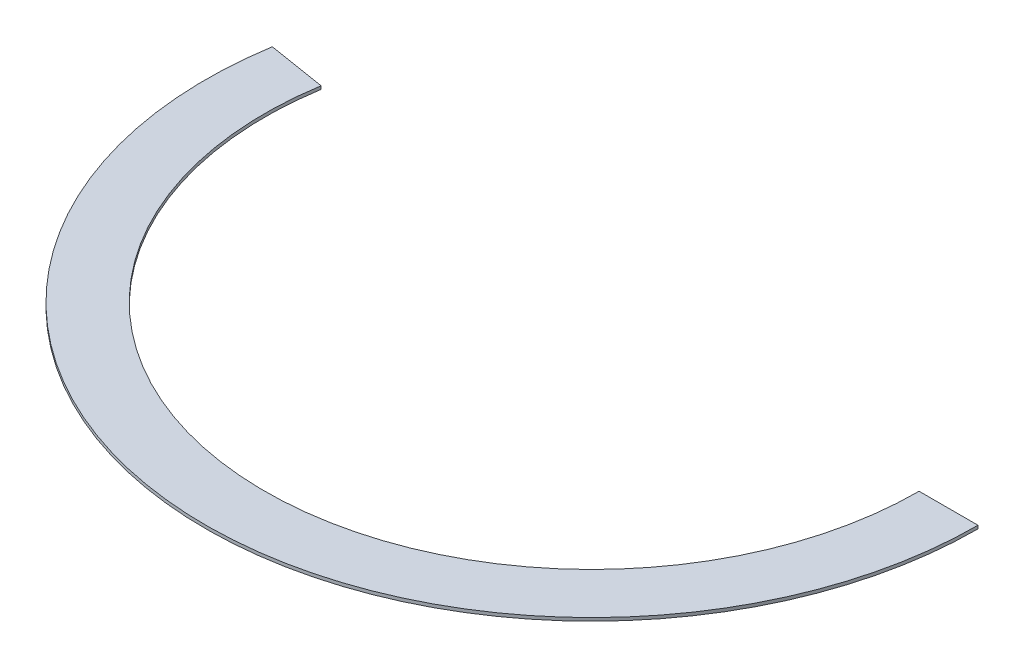
from build123d import *

# Parameters (mm, degrees)
BOSS_EXTRUDE1_DEPTH = 0.7


with BuildPart() as part:
    # Sketch3 → Boss-Extrude1 (new body)
    with BuildSketch(Plane(origin=(0, 0, 0), x_dir=(1, 0, 0), z_dir=(0, 1, 0))):
        with BuildLine():
            Line((-71.297017087, 11.509289924), (-84.13087505, 13.581025856))
            ThreePointArc((-84.13087505, 13.581025856), (-6.812313418, -84.947282393), (85.22, 0))
            Line((85.22, 0), (72.22, 0))
            ThreePointArc((72.22, 0), (-5.773119867, -71.988884468), (-71.297017087, 11.509289924))
        make_face()
    extrude(amount=BOSS_EXTRUDE1_DEPTH)


solid = part.part
